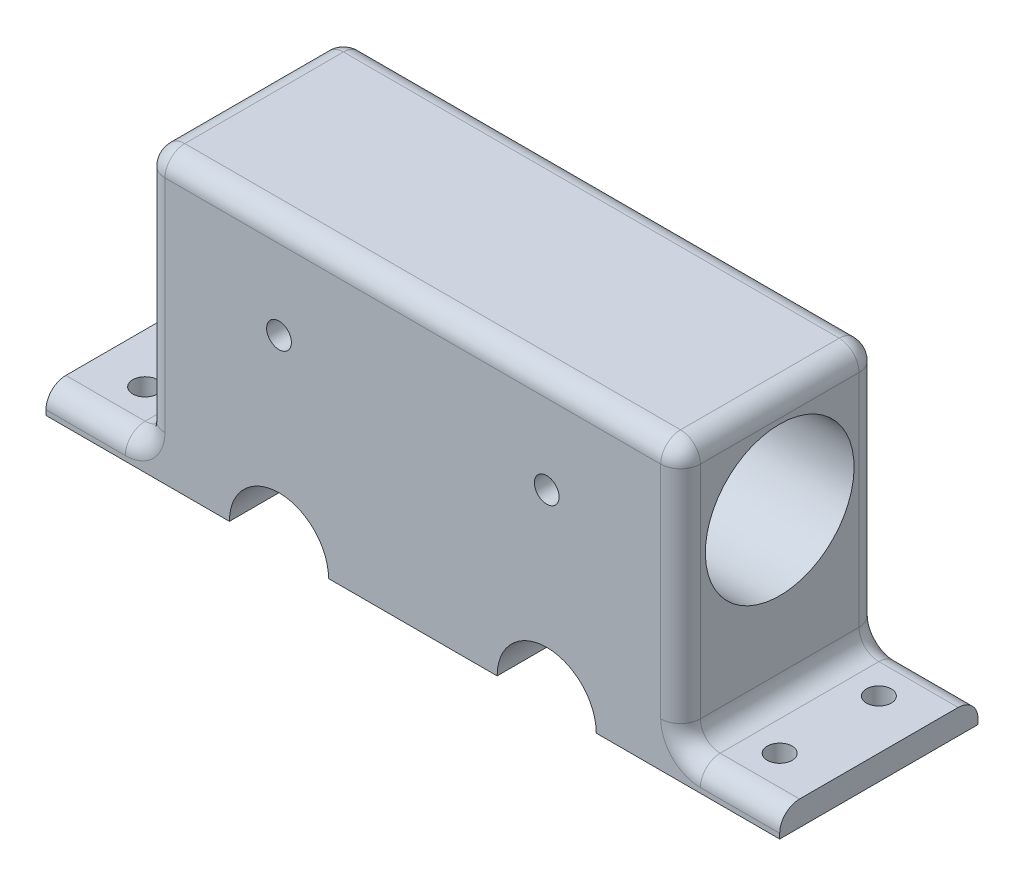
from build123d import *

# Parameters (mm, degrees)
BOSS_EXTRUDE1_DEPTH = 25.4
SKETCH2_R           = 1.5875
CUT_EXTRUDE1_DEPTH  = 63.965141199
SKETCH3_R           = 9.525
CUT_EXTRUDE2_DEPTH  = 93.653985647
SKETCH4_R           = 1.5875
CUT_EXTRUDE3_DEPTH  = 65.702262374
FILLET1_R           = 2.54


with BuildPart() as part:
    # Sketch1 → Boss-Extrude1 (new body)
    with BuildSketch(Plane.XY):
        with BuildLine():
            Line((-10.795, 0), (10.795, 0))
            ThreePointArc((10.795, 0), (17.145, 6.35), (23.495, 0))
            Line((23.495, 0), (46.99, 0))
            Line((46.99, 0), (46.99, 3.175))
            Line((46.99, 3.175), (36.83, 3.175))
            ThreePointArc((36.83, 3.175), (35.033948776, 3.918948776), (34.29, 5.715))
            Line((34.29, 5.715), (34.29, 36.5125))
            Line((34.29, 36.5125), (-34.29, 36.5125))
            Line((-34.29, 36.5125), (-34.29, 5.715))
            ThreePointArc((-34.29, 5.715), (-35.033948776, 3.918948776), (-36.83, 3.175))
            Line((-36.83, 3.175), (-46.99, 3.175))
            Line((-46.99, 3.175), (-46.99, 0))
            Line((-46.99, 0), (-23.495, 0))
            ThreePointArc((-23.495, 0), (-17.145, 6.35), (-10.795, 0))
        make_face()
    extrude(amount=BOSS_EXTRUDE1_DEPTH)

    # Sketch2 → Cut-Extrude1 (cut, through all)
    with BuildSketch(Plane(origin=(0, 3.175, 0), x_dir=(1, 0, 0), z_dir=(0, 1, 0))):
        with Locations((40.64, -6.35)):
            Circle(SKETCH2_R)
        with Locations((40.64, -19.05)):
            Circle(SKETCH2_R)
        with Locations((-40.64, -6.35)):
            Circle(SKETCH2_R)
        with Locations((-40.64, -19.05)):
            Circle(SKETCH2_R)
    extrude(amount=-CUT_EXTRUDE1_DEPTH, mode=Mode.SUBTRACT)

    # Sketch3 → Cut-Extrude2 (cut, through all)
    with BuildSketch(Plane(origin=(34.29, 0, 0), x_dir=(0, 0, -1), z_dir=(1, 0, 0))):
        with Locations((-12.7, 23.8125)):
            Circle(SKETCH3_R)
    extrude(amount=-CUT_EXTRUDE2_DEPTH, mode=Mode.SUBTRACT)

    # Sketch4 → Cut-Extrude3 (cut, through all)
    with BuildSketch(Plane.XY.offset(25.4)):
        with Locations((17.145, 23.8125)):
            Circle(SKETCH4_R)
        with Locations((-17.145, 23.8125)):
            Circle(SKETCH4_R)
    extrude(amount=-CUT_EXTRUDE3_DEPTH, mode=Mode.SUBTRACT)

    # Fillet1
    fillet1_edges = [part.edges().sort_by_distance(p)[0] for p in [
        (41.91, 3.175, 0),
        (35.033948776, 3.918948776, 0),
        (41.91, 3.175, 25.4),
        (35.033948776, 3.918948776, 25.4),
        (34.29, 21.11375, 0),
        (34.29, 21.11375, 25.4),
        (-41.91, 3.175, 0),
        (-35.033948776, 3.918948776, 0),
        (-41.91, 3.175, 25.4),
        (-35.033948776, 3.918948776, 25.4),
        (0, 36.5125, 0),
        (0, 36.5125, 25.4),
        (-34.29, 36.5125, 12.7),
        (-34.29, 21.11375, 0),
        (-34.29, 21.11375, 25.4),
        (34.29, 36.5125, 12.7),
    ]]
    fillet(fillet1_edges, radius=FILLET1_R)


solid = part.part
